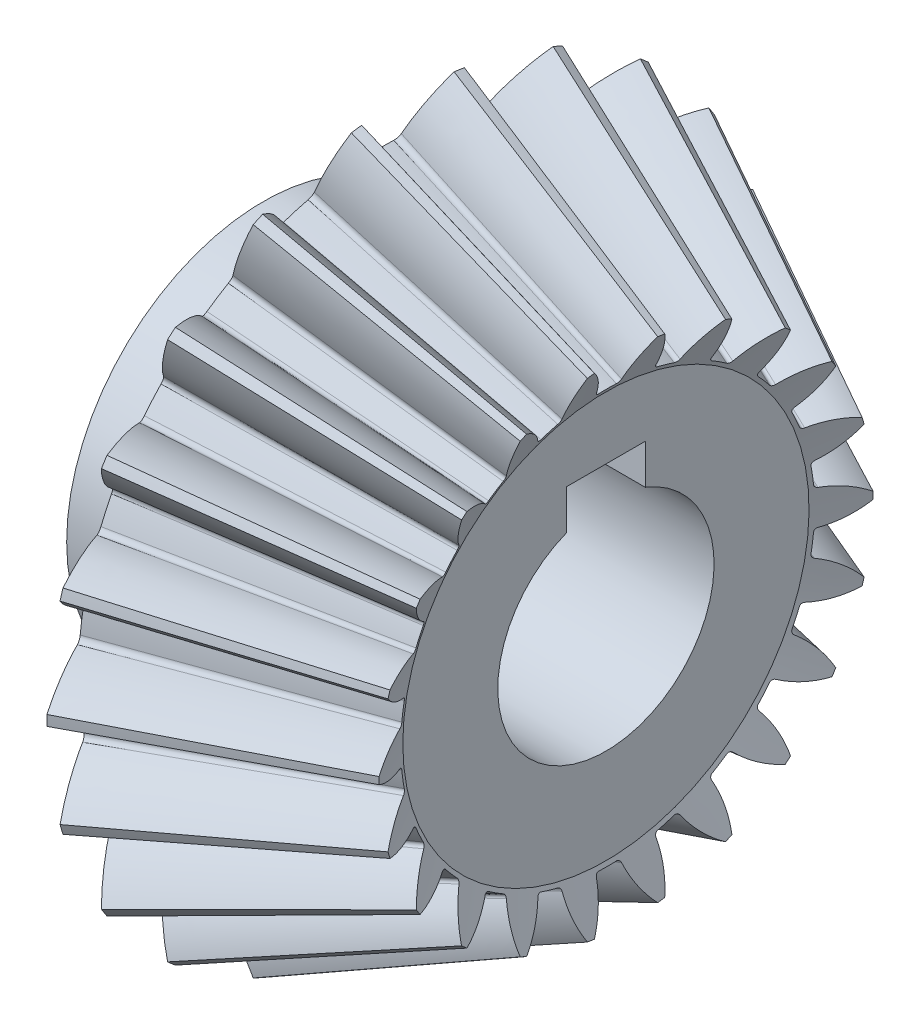
from build123d import *

# Parameters (mm, degrees)
TEETHCUTS_COUNT = 22
TEETHCUTS_ANGLE = 343.636363636
HUBSKE_R        = 20
HUB_DEPTH       = 11.711130341
BORSKE_R        = 11
BORE_DEPTH      = 85.0000508
KEYSKE_W        = 8
KEYSKE_H        = 14.3
KEYWAY_DEPTH    = 85.0000508


with BuildPart() as part:
    # BasProSke → Base-Revolve (revolve)
    with BuildSketch(Plane(origin=(0, 0, 0), x_dir=(1, 0, 0), z_dir=(0, 1, 0)), mode=Mode.PRIVATE) as base_revolve_sk:
        Polygon((0, 0), (0, 30.187699073), (2.993132429, 36.718169819), (25.18183877, 25.128171007), (23.133481134, 20.659027079), (23.133481134, 0), align=None)
    revolve(base_revolve_sk.sketch.rotate(Axis((-10, 0, 0), (1, 0, 0)), 180), axis=Axis((-10, 0, 0), (1, 0, 0)))

    # ToothCut: read off the stored shape, not the designer's step
    # ToothCut: loft between two sections, ruled curve by curve
    toothcut_from = [
        Edge.make_bspline([(73.292371644, 0.00741902, -0.009730616), (73.290062785, 0.002381509, -0.014378279), (73.287056695, -0.004177233, -0.013873848), (73.285039762, -0.008577814, -0.008500303)], [0, 0, 0, 0, 1, 1, 1, 1], 3, [1, 0.813003238, 0.813003238, 1]),
        Edge.make_bspline([(73.285039762, -0.008577814, 0.008500303), (73.287056695, -0.004177233, 0.013873848), (73.290062785, 0.002381509, 0.014378279), (73.292371644, 0.00741902, 0.009730616)], [0, 0, 0, 0, 1, 1, 1, 1], 3, [1, 0.813003238, 0.813003238, 1]),
        Edge.make_bspline([(73.285039762, -0.008577814, -0.008500303), (73.284731261, -0.009250907, -0.007678391), (73.284469867, -0.009821222, -0.006767249), (73.284260009, -0.010279093, -0.005782322)], [0, 0, 0, 0, 1, 1, 1, 1], 3, [1, 0.994349657, 0.994349657, 1]),
        Edge.make_bspline([(73.284260009, -0.010279093, 0.005782322), (73.284469867, -0.009821222, 0.006767249), (73.284731261, -0.009250907, 0.007678391), (73.285039762, -0.008577814, 0.008500303)], [0, 0, 0, 0, 1, 1, 1, 1], 3, [1, 0.994349657, 0.994349657, 1]),
        Edge.make_bspline([(73.284260009, -0.010279093, -0.005782322), (73.283471046, -0.012000467, -0.002079467), (73.283471046, -0.012000467, 0.002079467), (73.284260009, -0.010279093, 0.005782322)], [0, 0, 0, 0, 1, 1, 1, 1], 3, [1, 0.926891727, 0.926891727, 1]),
        Edge.make_line((73.292371644, 0.00741902, 0.009730616), (73.292371644, 0.00741902, -0.009730616)),
    ]
    toothcut_to = [
        Edge.make_bspline([(3.147451447, 37.054865857, -5.28824508), (2.391232174, 35.404932899, -3.543317475), (1.462425193, 33.378444943, -2.373025692), (0.434554528, 31.135818043, -1.870009607)], [0, 0, 0, 0, 1, 1, 1, 1], 3, [1, 0.973613454, 0.973613454, 1]),
        Edge.make_bspline([(0.434554528, 31.135818043, 1.870009607), (1.462425193, 33.378444943, 2.373025692), (2.391232174, 35.404932899, 3.543317475), (3.147451447, 37.054865857, 5.28824508)], [0, 0, 0, 0, 1, 1, 1, 1], 3, [1, 0.973613454, 0.973613454, 1]),
        Edge.make_bspline([(0.434554528, 31.135818043, -1.870009607), (0.315871961, 30.876874259, -1.811929108), (0.241259744, 30.714083967, -1.582924486), (0.246388337, 30.725273626, -1.292477816)], [0, 0, 0, 0, 1, 1, 1, 1], 3, [1, 0.840640661, 0.840640661, 1]),
        Edge.make_bspline([(0.246388337, 30.725273626, 1.292477816), (0.241259744, 30.714083967, 1.582924486), (0.315871961, 30.876874259, 1.811929108), (0.434554528, 31.135818043, 1.870009607)], [0, 0, 0, 0, 1, 1, 1, 1], 3, [1, 0.840640661, 0.840640661, 1]),
        Edge.make_bspline([(0.246388337, 30.725273626, -1.292477816), (0.261598498, 30.758459431, -0.43108367), (0.261598498, 30.758459431, 0.43108367), (0.246388337, 30.725273626, 1.292477816)], [0, 0, 0, 0, 1, 1, 1, 1], 3, [1, 0.999402132, 0.999402132, 1]),
        Edge.make_line((3.147451447, 37.054865857, 5.28824508), (3.147451447, 37.054865857, -5.28824508)),
    ]
    toothcut = Solid(Shell([*[Face.make_surface_from_curves(toothcut_from[k], toothcut_to[k]) for k in range(6)], Face(Wire(toothcut_from)), Face(Wire(toothcut_to))]))
    add(toothcut, mode=Mode.SUBTRACT)

    # TeethCuts: ToothCut ×22 about axis
    teethcuts_axis = Axis((-10, 0, 0), (1, 0, 0))
    for i in range(1, TEETHCUTS_COUNT):
        add(toothcut.rotate(teethcuts_axis, i * TEETHCUTS_ANGLE / (TEETHCUTS_COUNT - 1)), mode=Mode.SUBTRACT)

    # HubSke → Hub (add)
    with BuildSketch(Plane.ZY):
        with Locations(Location((0, 0, 0), (0, 0, 180))):
            Circle(HUBSKE_R)
    extrude(amount=HUB_DEPTH)

    # BorSke → Bore (cut, symmetric)
    with BuildSketch(Plane(origin=(0, 0, 0), x_dir=(0, 0, -1), z_dir=(1, 0, 0))):
        with Locations(Location((0, 0, 0), (0, 0, 180))):
            Circle(BORSKE_R)
    extrude(amount=BORE_DEPTH, both=True, mode=Mode.SUBTRACT)

    # KeySke → Keyway (cut, symmetric)
    with BuildSketch(Plane(origin=(0, 0, 0), x_dir=(0, 0, -1), z_dir=(1, 0, 0))):
        with Locations((0, 7.15)):
            Rectangle(KEYSKE_W, KEYSKE_H)
    extrude(amount=KEYWAY_DEPTH, both=True, mode=Mode.SUBTRACT)


solid = part.part
